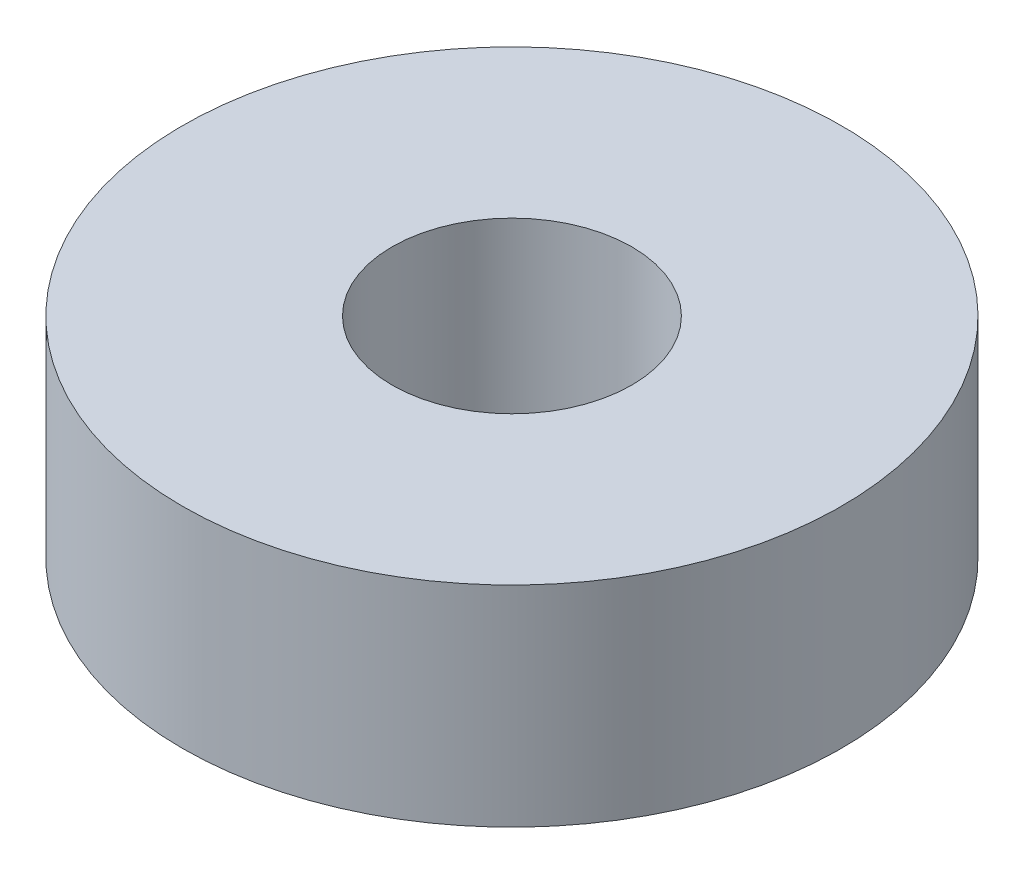
from build123d import *

# Parameters (mm, degrees)
BOSS_EXTRUDE1_DEPTH      = 3.5
BOSS_EXTRUDE1_DEPTH_BACK = 3.5
SKETCH1_R                = 11
SKETCH1_R_2              = 4


with BuildPart() as part:
    # Sketch1 → Boss-Extrude1 (new, two sides: drawn at the far end of the back side and taken through both)
    with BuildSketch(Plane(origin=(0, 0, 0), x_dir=(1, 0, 0), z_dir=(0, 1, 0)).offset(-BOSS_EXTRUDE1_DEPTH_BACK)):
        Circle(SKETCH1_R)
        Circle(SKETCH1_R_2, mode=Mode.SUBTRACT)
    extrude(amount=BOSS_EXTRUDE1_DEPTH + BOSS_EXTRUDE1_DEPTH_BACK)


solid = part.part
